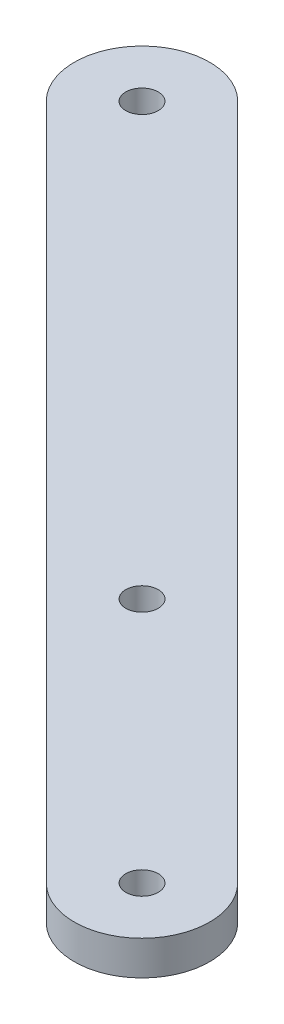
from build123d import *

# Parameters (mm, degrees)
SKETCH1_R           = 3
BOSS_EXTRUDE1_DEPTH = 3.175


with BuildPart() as part:
    # Sketch1 → Boss-Extrude1 (new, symmetric)
    with BuildSketch(Plane(origin=(0, 0, 0), x_dir=(1, 0, 0), z_dir=(0, 1, 0))):
        with BuildLine():
            Line((133.838834765, -116.161165235), (8.838834765, 8.838834765))
            ThreePointArc((8.838834765, 8.838834765), (-8.838834765, 8.838834765), (-8.838834765, -8.838834765))
            Line((-8.838834765, -8.838834765), (116.161165235, -133.838834765))
            ThreePointArc((116.161165235, -133.838834765), (133.838834765, -133.838834765), (133.838834765, -116.161165235))
        make_face()
        with Locations((125, -125)):
            Circle(SKETCH1_R, mode=Mode.SUBTRACT)
        with Locations((79.583029745, -79.583029745)):
            Circle(SKETCH1_R, mode=Mode.SUBTRACT)
        Circle(SKETCH1_R, mode=Mode.SUBTRACT)
    extrude(amount=BOSS_EXTRUDE1_DEPTH, both=True)


solid = part.part
